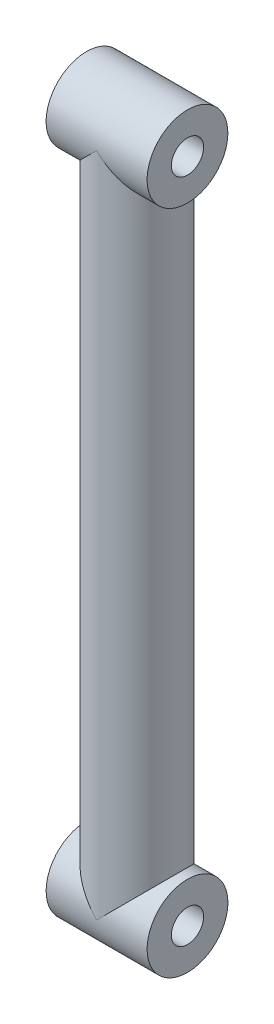
from build123d import *

# Parameters (mm, degrees)
SKETCH1_R                = 10
BOSS_EXTRUDE1_DEPTH      = 165
BOSS_EXTRUDE2_DEPTH      = 12.5
BOSS_EXTRUDE2_DEPTH_BACK = 12.5
SKETCH2_R                = 10
SKETCH2_R_2              = 4
CUT_EXTRUDE1_DEPTH       = 176.730617715
CUT_EXTRUDE1_DEPTH_BACK  = 176.730617715
SKETCH2_2_R              = 4


with BuildPart() as part:
    # Sketch1 → Boss-Extrude1 (new body)
    with BuildSketch(Plane(origin=(0, 0, 0), x_dir=(1, 0, 0), z_dir=(0, 1, 0))):
        Circle(SKETCH1_R)
    extrude(amount=BOSS_EXTRUDE1_DEPTH)


with BuildPart() as boss_extrude2_tool:
    # Sketch2 → Boss-Extrude2 (new, two sides: drawn at the far end of the back side and taken through both)
    # profile 1 of 2: a face of its own
    with BuildSketch(Plane(origin=(0, 0, 0), x_dir=(0, 0, -1), z_dir=(1, 0, 0)).offset(-BOSS_EXTRUDE2_DEPTH_BACK)):
        with Locations((0, 165)):
            Circle(SKETCH2_R)
        with Locations((0, 165)):
            Circle(SKETCH2_R_2, mode=Mode.SUBTRACT)
    # profile 2 of 2: a face of its own
    with BuildSketch(Plane(origin=(0, 0, 0), x_dir=(0, 0, -1), z_dir=(1, 0, 0)).offset(-BOSS_EXTRUDE2_DEPTH_BACK)):
        Circle(SKETCH2_R)
        Circle(SKETCH2_R_2, mode=Mode.SUBTRACT)
    extrude(amount=BOSS_EXTRUDE2_DEPTH + BOSS_EXTRUDE2_DEPTH_BACK)


with BuildPart() as part_1:
    add(part.part)


with BuildPart() as part_2:
    # Boss-Extrude2: joined with boss_extrude2_tool
    add(part_1.part.fuse(boss_extrude2_tool.part, tol=0.00001))

    # Sketch2<2> → Cut-Extrude1 (cut, two sides: drawn at the far end of the back side and taken through both)
    with BuildSketch(Plane(origin=(0, 0, 0), x_dir=(0, 0, -1), z_dir=(1, 0, 0)).offset(-CUT_EXTRUDE1_DEPTH_BACK)):
        with Locations((0, 165)):
            Circle(SKETCH2_2_R)
        Circle(SKETCH2_2_R)
    extrude(amount=CUT_EXTRUDE1_DEPTH + CUT_EXTRUDE1_DEPTH_BACK, mode=Mode.SUBTRACT)


solid = part_2.part
